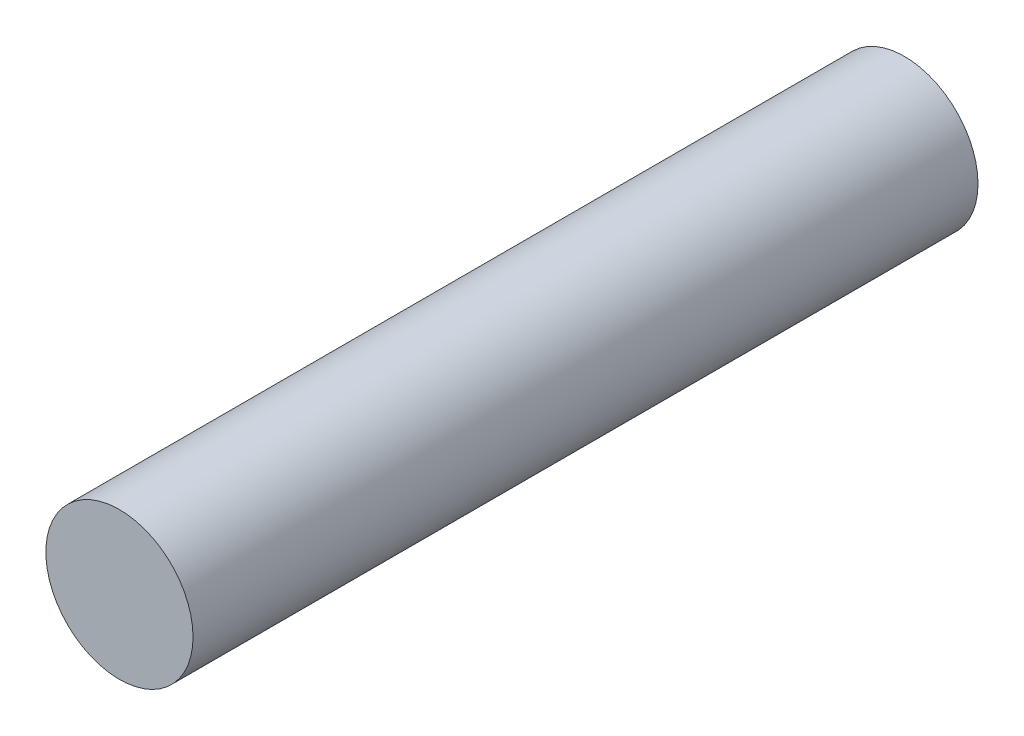
from build123d import *

# Parameters (mm, degrees)
SKETCH_2_R          = 7.5
EXTRUDE_1_DEPTH     = 80
SKETCH_2_3_R        = 4
CUT_EXTRUDE_1_DEPTH = 30
SKETCH_3_R          = 2
CUT_EXTRUDE_2_DEPTH = 10


with BuildPart() as part:
    # 스케치2 → 보스-돌출1 (new body)
    with BuildSketch(Plane.XY):
        Circle(SKETCH_2_R)
    extrude(amount=EXTRUDE_1_DEPTH)

    # 스케치2<3> → 컷-돌출1 (cut)
    with BuildSketch(Plane.XY):
        Circle(SKETCH_2_3_R)
    extrude(amount=CUT_EXTRUDE_1_DEPTH, mode=Mode.SUBTRACT)

    # 스케치3 → 컷-돌출2 (cut)
    with BuildSketch(Plane(origin=(0, 0, 0), x_dir=(1, 0, 0), z_dir=(0, 1, 0))):
        with Locations((0, -25)):
            Circle(SKETCH_3_R)
        with Locations((0, -75)):
            Circle(SKETCH_3_R)
    extrude(amount=-CUT_EXTRUDE_2_DEPTH, mode=Mode.SUBTRACT)


solid = part.part
